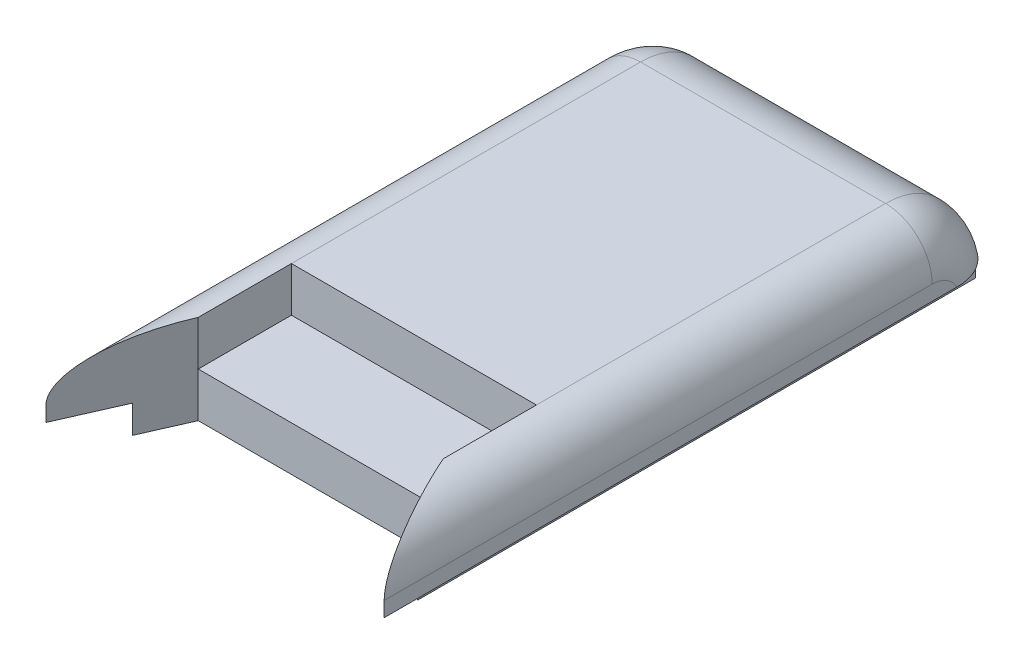
from build123d import *

# Parameters (mm, degrees)
SKETCH1_W                = 58
SKETCH1_H                = 65
BOSS_EXTRUDE1_DEPTH      = 30
BOSS_EXTRUDE3_REACH      = 92.09
SKETCH10_W               = 5
SKETCH10_H               = 14
CUT_EXTRUDE1_REACH       = 111.372
SKETCH2_R                = 2.45
SKETCH2_R_2              = 2.55
CUT_EXTRUDE2_REACH       = 91.744
SKETCH3_W                = 12.4
SKETCH3_H                = 10.4
SKETCH11_W               = 3
SKETCH11_H               = 2
BOSS_EXTRUDE4_DEPTH      = 6.3
FILLET3_R                = 1.5
SKETCH12_R               = 0.5
CUT_EXTRUDE3_DEPTH       = 92.15338732
FILLET3_OF_MIRROR1_R     = 1.5
BOSS_EXTRUDE5_REACH      = 111.564
SKETCH13_W               = 15
SKETCH13_H               = 6
BOSS_EXTRUDE6_REACH      = 111.564
SKETCH17_W               = 15
SKETCH17_H               = 14
CUT_EXTRUDE18_REACH      = 129.651
SKETCH35_W               = 16
SKETCH35_H               = 6
FILLET5_R                = 3
BOSS_EXTRUDE7_START      = 20.2
BOSS_EXTRUDE7_DEPTH      = 9.8
BOSS_EXTRUDE8_DEPTH      = 20
CUT_EXTRUDE15_REACH      = 95.637
SKETCH28_R               = 0.8
FILLET4_R                = 3
CUT_EXTRUDE16_REACH      = 96.767
SKETCH29_R               = 1.6
SKETCH30_W               = 14
SKETCH30_H               = 1.5
BOSS_EXTRUDE9_DEPTH      = 6.1
SKETCH31_W               = 1.3
SKETCH31_H               = 14
BOSS_EXTRUDE10_DEPTH     = 5
CUT_EXTRUDE17_REACH      = 99.736
FILLET11_R               = 1
FILLET11_OF_MIRROR4_R    = 1
MIRROR5_START            = 2.5
MIRROR5_OUTLINE_W        = 1.5
MIRROR5_OUTLINE_H        = 14
MIRROR5_DEPTH            = 6.1
MIRROR5_START_2          = 7.3
MIRROR5_2_DEPTH          = 1.3
SKETCH36_W               = 22.4
SKETCH36_H               = 14.8
BOSS_EXTRUDE12_DEPTH     = 14
CUT_EXTRUDE19_DEPTH      = 3
CUT_EXTRUDE20_DEPTH      = 11
CUT_EXTRUDE21_REACH      = 101.088
SKETCH41_W               = 3
SKETCH41_H               = 35
BOSS_EXTRUDE13_DEPTH     = 2
BOSS_EXTRUDE14_START     = -1.789079
SKETCH43_W               = 36.284482562
SKETCH43_H               = 9.6
BOSS_EXTRUDE14_DEPTH     = 66.789079
BOSS_EXTRUDE15_REACH     = 152.996
SKETCH44_W               = 2.842240903
SKETCH44_H               = 50
FILLET6_R                = 8
FILLET7_R                = 5
SKETCH45_W               = 17
SKETCH45_H               = 8
CUT_EXTRUDE22_DEPTH      = 166.644015889
BOSS_EXTRUDE16_REACH     = 152.29
SKETCH46_W               = 4.5
SKETCH46_H               = 5
BOSS_EXTRUDE17_START     = -30
BOSS_EXTRUDE17_DEPTH     = 30
SKETCH49_W               = 8
SKETCH49_H               = 9
CUT_EXTRUDE23_DEPTH      = 8
SKETCH50_R               = 2.45
CUT_EXTRUDE24_DEPTH      = 4.5
CUT_EXTRUDE25_START      = 13.5
SKETCH51_R               = 2.45
CUT_EXTRUDE25_DEPTH      = 4.5
BOSS_EXTRUDE18_REACH     = 165.708
SKETCH53_W               = 5
SKETCH53_H               = 10
SKETCH55_W               = 58
SKETCH55_H               = 10
BOSS_EXTRUDE20_DEPTH     = 4
CUT_EXTRUDE9_START       = -10
SKETCH19_W               = 30
SKETCH19_H               = 15
CUT_EXTRUDE9_DEPTH       = 10
SKETCH58_W               = 70
SKETCH58_H               = 9
CUT_EXTRUDE27_DEPTH      = 153.77843439
BOSS_EXTRUDE22_REACH     = 153.411
SKETCH59_W               = 30
SKETCH59_H               = 5
CUT_EXTRUDE28_REACH      = 183.113
SKETCH18_R               = 1.5
FILLET9_R                = 2
FILLET10_R               = 1
SKETCH60_W               = 70
SKETCH60_H               = 3
BOSS_EXTRUDE23_DEPTH     = 30
CUT_EXTRUDE29_DEPTH      = 7.5
CUT_EXTRUDE30_DEPTH      = 3
SKETCH64_W               = 58
SKETCH64_H               = 4
BOSS_EXTRUDE24_DEPTH     = 6
CUT_EXTRUDE31_DEPTH      = 7.5
CUT_EXTRUDE32_DEPTH      = 153.77843439
CUT_EXTRUDE32_DEPTH_BACK = 153.77843439
SKETCH66_W               = 26.284482562
SKETCH66_H               = 4.8
CUT_EXTRUDE33_DEPTH      = 10
SKETCH70_W               = 39.429423432
SKETCH70_H               = 70.844211971
CUT_EXTRUDE36_DEPTH      = 147.073785918
SKETCH71_W               = 2.84
SKETCH71_H               = 69.475636784
SKETCH71_H_2             = 74.91392287
CUT_EXTRUDE37_DEPTH      = 3


# Read off the part's stored shape, not the designer's step: Mirror5
# Some blends are built 0.0001 mm under size
with BuildPart() as part:
    # Sketch1 → Boss-Extrude1 (new body)
    with BuildSketch(Plane(origin=(0, 0, 0), x_dir=(1, 0, 0), z_dir=(0, 1, 0))):
        Polygon((-35, 38.5), (-17.352941176, 78.5), (17.352941947, 78.5), (35, 38.5), (35, -38.5), (-35, -38.5), align=None)
        Rectangle(SKETCH1_W, SKETCH1_H, mode=Mode.SUBTRACT)
        Polygon((-28.44203382, 38.5), (28.442033867, 38.5), (13.442034522, 72.5), (-13.44203382, 72.5), align=None, mode=Mode.SUBTRACT)
    extrude(amount=BOSS_EXTRUDE1_DEPTH)

    # Sketch7 → Loft3 section 0
    with BuildSketch(Plane.XY.offset(-32.5)):
        with BuildLine():
            Line((-8.6, 30), (8.6, 30))
            Line((8.6, 30), (8.6, 27))
            Line((8.6, 27), (-8.6, 27))
            Line((-8.6, 27), (-8.6, 30))
        make_face()
    # Sketch8 → Loft3 section 1
    with BuildSketch(Plane.XY.offset(38.5)):
        with BuildLine():
            Line((-8.6, 30), (8.6, 30))
            Line((8.6, 30), (8.6, 27))
            Line((8.6, 27), (-8.6, 27))
            Line((-8.6, 27), (-8.6, 30))
        make_face()
    loft3 = loft()

    # Mirror3: Loft3 across plane
    add(loft3.mirror(Plane(origin=(0, 15, 0), x_dir=(0, 0, 1), z_dir=(0, -1, 0))))

    # Sketch10 → Boss-Extrude3 (add, up to next)
    with BuildSketch(Plane.XZ.offset(-27), mode=Mode.PRIVATE) as boss_extrude3_sk1:
        with Locations((0, 2.5)):
            Rectangle(SKETCH10_W, SKETCH10_H)
    boss_extrude3_tool1 = extrude(boss_extrude3_sk1.sketch, amount=BOSS_EXTRUDE3_REACH, mode=Mode.PRIVATE) - part.part
    add(boss_extrude3_tool1.solids().sort_by_distance((0, 27, 2.5))[0])

    # Sketch2 → Cut-Extrude1 (cut, up to next)
    with BuildSketch(Plane(origin=(35, 0, 0), x_dir=(0, 0, -1), z_dir=(1, 0, 0)), mode=Mode.PRIVATE) as cut_extrude1_sk1:
        with Locations((-2.5, 15)):
            Circle(SKETCH2_R)
    cut_extrude1_tool1 = extrude(cut_extrude1_sk1.sketch, amount=-CUT_EXTRUDE1_REACH, mode=Mode.PRIVATE) & part.part
    # Sketch2 → Cut-Extrude1 (cut, up to next)
    with BuildSketch(Plane(origin=(35, 0, 0), x_dir=(0, 0, -1), z_dir=(1, 0, 0)), mode=Mode.PRIVATE) as cut_extrude1_sk2:
        with Locations((19.5, 15)):
            Circle(SKETCH2_R_2)
    cut_extrude1_tool2 = extrude(cut_extrude1_sk2.sketch, amount=-CUT_EXTRUDE1_REACH, mode=Mode.PRIVATE) & part.part
    cut_extrude1_1 = cut_extrude1_tool1.solids().sort_by_distance((35, 15, 2.5))[0]
    add(cut_extrude1_1, mode=Mode.SUBTRACT)
    cut_extrude1_2 = cut_extrude1_tool2.solids().sort_by_distance((35, 15, -19.5))[0]
    add(cut_extrude1_2, mode=Mode.SUBTRACT)
    cut_extrude1 = cut_extrude1_1 + cut_extrude1_2  # Cut-Extrude1 as one shape, for the pattern or mirror that repeats it

    # Sketch3 → Cut-Extrude2 (cut, up to next)
    with BuildSketch(Plane(origin=(0, 0, -38.5), x_dir=(-1, 0, 0), z_dir=(0, 0, -1)), mode=Mode.PRIVATE) as cut_extrude2_sk1:
        with Locations((0, 15)):
            Rectangle(SKETCH3_W, SKETCH3_H)
    cut_extrude2_tool1 = extrude(cut_extrude2_sk1.sketch, amount=-CUT_EXTRUDE2_REACH, mode=Mode.PRIVATE) & part.part
    add(cut_extrude2_tool1.solids().sort_by_distance((0, 15, -38.5))[0], mode=Mode.SUBTRACT)

    # Sketch11 → Boss-Extrude4 (add)
    with BuildSketch(Plane(origin=(35, 0, 0), x_dir=(0, 0, -1), z_dir=(1, 0, 0))):
        with Locations((2.5, 20)):
            Rectangle(SKETCH11_W, SKETCH11_H)
        with Locations((2.5, 10)):
            Rectangle(SKETCH11_W, SKETCH11_H)
    boss_extrude4 = extrude(amount=BOSS_EXTRUDE4_DEPTH)

    # Fillet3
    fillet3_edges = [part.edges().sort_by_distance(p)[0] for p in [
        (41.3, 10, -1),
        (41.3, 10, -4),
        (41.3, 20, -1),
        (41.3, 20, -4),
    ]]
    fillet(fillet3_edges, radius=FILLET3_R - 0.0001)  # a hair under: the kernel refuses the full size

    # Sketch12 → Cut-Extrude3 (cut, through all)
    with BuildSketch(Plane(origin=(0, 21, 0), x_dir=(1, 0, 0), z_dir=(0, 1, 0))):
        with Locations(Location((39.8, 2.5, 0), (0, 0, 270))):
            Circle(SKETCH12_R)
    cut_extrude3 = extrude(amount=-CUT_EXTRUDE3_DEPTH, mode=Mode.SUBTRACT)

    # Mirror1: Cut-Extrude1, Boss-Extrude4, Cut-Extrude3 across plane
    add(cut_extrude1.mirror(Plane(origin=(0, 0, 0), x_dir=(0, 0, 1), z_dir=(1, 0, 0))), mode=Mode.SUBTRACT)
    add(boss_extrude4.mirror(Plane(origin=(0, 0, 0), x_dir=(0, 0, 1), z_dir=(1, 0, 0))))
    add(cut_extrude3.mirror(Plane(origin=(0, 0, 0), x_dir=(0, 0, 1), z_dir=(1, 0, 0))), mode=Mode.SUBTRACT)

    # Fillet3 of Mirror1
    fillet3_of_mirror1_edges = [part.edges().sort_by_distance(p)[0] for p in [
        (-41.3, 10, -1),
        (-41.3, 10, -4),
        (-41.3, 20, -1),
        (-41.3, 20, -4),
    ]]
    fillet(fillet3_of_mirror1_edges, radius=FILLET3_OF_MIRROR1_R - 0.0001)  # a hair under: the kernel refuses the full size

    # Sketch13 → Boss-Extrude5 (add, up to next)
    with BuildSketch(Plane(origin=(-29, 0, 0), x_dir=(0, 0, -1), z_dir=(1, 0, 0)), mode=Mode.PRIVATE) as boss_extrude5_sk1:
        with Locations((-25, 27)):
            Rectangle(SKETCH13_W, SKETCH13_H)
    boss_extrude5_tool1 = extrude(boss_extrude5_sk1.sketch, amount=BOSS_EXTRUDE5_REACH, mode=Mode.PRIVATE) - part.part
    add(boss_extrude5_tool1.solids().sort_by_distance((-29, 27, 25))[0])

    # Sketch17 → Boss-Extrude6 (add, up to next)
    with BuildSketch(Plane(origin=(-29, 0, 0), x_dir=(0, 0, -1), z_dir=(1, 0, 0)), mode=Mode.PRIVATE) as boss_extrude6_sk1:
        with Locations((-25, 7)):
            Rectangle(SKETCH17_W, SKETCH17_H)
    boss_extrude6_tool1 = extrude(boss_extrude6_sk1.sketch, amount=BOSS_EXTRUDE6_REACH, mode=Mode.PRIVATE) - part.part
    add(boss_extrude6_tool1.solids().sort_by_distance((-29, 7, 25))[0])

    # Sketch35 → Cut-Extrude18 (cut, up to next)
    with BuildSketch(Plane(origin=(0, 0, -78.5), x_dir=(-1, 0, 0), z_dir=(0, 0, -1)), mode=Mode.PRIVATE) as cut_extrude18_sk1:
        with Locations((0, 15)):
            Rectangle(SKETCH35_W, SKETCH35_H)
    cut_extrude18_tool1 = extrude(cut_extrude18_sk1.sketch, amount=-CUT_EXTRUDE18_REACH, mode=Mode.PRIVATE) & part.part
    add(cut_extrude18_tool1.solids().sort_by_distance((0, 15, -78.5))[0], mode=Mode.SUBTRACT)

    # Fillet5
    fillet5_edges = [part.edges().sort_by_distance(p)[0] for p in [
        (-35, 15, -38.5),
        (-17.352941176, 15, -78.5),
        (17.352941947, 15, -78.5),
        (35, 15, -38.5),
        (-8, 15, -78.5),
        (8, 15, -78.5),
    ]]
    fillet(fillet5_edges, radius=FILLET5_R)

    # Sketch24 → Boss-Extrude7 (add)
    with BuildSketch(Plane(origin=(0, 0, 0), x_dir=(1, 0, 0), z_dir=(0, 1, 0)).offset(BOSS_EXTRUDE7_START)):
        Polygon((9.15, 49.5), (9.15, 72.5), (6.15, 72.5), (6.15, 49.5), (-6.15, 49.5), (-6.15, 72.5), (-9.15, 72.5), (-9.15, 49.5), (-23.589092644, 49.5), (-26.23615161, 43.5), (26.23615161, 43.5), (23.589092902, 49.5), align=None)
    extrude(amount=BOSS_EXTRUDE7_DEPTH)

    # Sketch26 → Boss-Extrude8 (add)
    with BuildSketch(Plane(origin=(0, 0, -38.5), x_dir=(-1, 0, 0), z_dir=(0, 0, -1))):
        Polygon((-11.2, 4.8), (-11.2, 0), (11.2, 0), (11.2, 4.8), (11.2, 14.8), (6.2, 14.8), (6.2, 9.8), (-6.2, 9.8), (-6.2, 14.8), (-11.2, 14.8), align=None)
    extrude(amount=BOSS_EXTRUDE8_DEPTH)

    # Sketch28 → Cut-Extrude15 (cut, up to next)
    with BuildSketch(Plane(origin=(0, 30, 0), x_dir=(-1, 0, 0), z_dir=(0, 1, 0)), mode=Mode.PRIVATE) as cut_extrude15_sk1:
        with Locations(Location((0, -46.5, 0), (0, 0, 90))):
            Circle(SKETCH28_R)
    cut_extrude15_tool1 = extrude(cut_extrude15_sk1.sketch, amount=-CUT_EXTRUDE15_REACH, mode=Mode.PRIVATE) & part.part
    # Sketch28 → Cut-Extrude15 (cut, up to next)
    with BuildSketch(Plane(origin=(0, 30, 0), x_dir=(-1, 0, 0), z_dir=(0, 1, 0)), mode=Mode.PRIVATE) as cut_extrude15_sk2:
        with Locations(Location((0, -75.5, 0), (0, 0, 90))):
            Circle(SKETCH28_R)
    cut_extrude15_tool2 = extrude(cut_extrude15_sk2.sketch, amount=-CUT_EXTRUDE15_REACH, mode=Mode.PRIVATE) & part.part
    add(cut_extrude15_tool1.solids().sort_by_distance((0, 30, -46.5))[0], mode=Mode.SUBTRACT)
    add(cut_extrude15_tool2.solids().sort_by_distance((0, 30, -75.5))[0], mode=Mode.SUBTRACT)

    # Fillet4
    fillet4_edges = [part.edges().sort_by_distance(p)[0] for p in [
        (35, 19, -2.5),
        (35, 20, -4),
        (35, 21, -2.5),
        (35, 11, -2.5),
        (35, 9, -2.5),
        (35, 10, -4),
        (-35, 19, -2.5),
        (-35, 20, -4),
        (-35, 21, -2.5),
        (-35, 11, -2.5),
        (-35, 9, -2.5),
        (-35, 10, -4),
    ]]
    fillet(fillet4_edges, radius=FILLET4_R)

    # Sketch29 → Cut-Extrude16 (cut, up to next)
    with BuildSketch(Plane(origin=(2.5, 0, 0), x_dir=(0, 0, -1), z_dir=(1, 0, 0)), mode=Mode.PRIVATE) as cut_extrude16_sk1:
        with Locations(Location((-2.5, 15, 0), (0, 0, 90))):
            Circle(SKETCH29_R)
    cut_extrude16_tool1 = extrude(cut_extrude16_sk1.sketch, amount=-CUT_EXTRUDE16_REACH, mode=Mode.PRIVATE) & part.part
    add(cut_extrude16_tool1.solids().sort_by_distance((2.5, 15, 2.5))[0], mode=Mode.SUBTRACT)

    # Sketch30 → Boss-Extrude9 (add)
    with BuildSketch(Plane.ZY.offset(2.5)):
        with Locations((2.5, 26.25)):
            Rectangle(SKETCH30_W, SKETCH30_H)
    boss_extrude9 = extrude(amount=BOSS_EXTRUDE9_DEPTH)

    # Sketch31 → Boss-Extrude10 (add)
    with BuildSketch(Plane.XZ.offset(-25.5)):
        with Locations((-7.95, 2.5)):
            Rectangle(SKETCH31_W, SKETCH31_H)
    boss_extrude10 = extrude(amount=BOSS_EXTRUDE10_DEPTH)

    # Sketch32 → Cut-Extrude17 (cut, up to next)
    with BuildSketch(Plane.ZY.offset(8.6), mode=Mode.PRIVATE) as cut_extrude17_sk1:
        with BuildLine():
            Line((-4.5, 20.5), (-4.5, 20.656854249))
            ThreePointArc((-4.5, 20.656854249), (2.5, 24), (9.5, 20.656854249))
            Line((9.5, 20.656854249), (9.5, 20.5))
            Line((9.5, 20.5), (-4.5, 20.5))
        make_face()
    cut_extrude17_tool1 = extrude(cut_extrude17_sk1.sketch, amount=-CUT_EXTRUDE17_REACH, mode=Mode.PRIVATE) & part.part
    cut_extrude17 = cut_extrude17_tool1.solids().sort_by_distance((-8.6, 21.927092, 2.5))[0]
    add(cut_extrude17, mode=Mode.SUBTRACT)

    # Fillet11
    fillet11_edges = [part.edges().sort_by_distance(p)[0] for p in [
        (-7.95, 20.656854249, 9.5),
        (-7.95, 20.656854249, -4.5),
    ]]
    fillet(fillet11_edges, radius=FILLET11_R)

    # Mirror4: Boss-Extrude9, Boss-Extrude10, Cut-Extrude17 across plane
    add(boss_extrude9.mirror(Plane(origin=(0, 15, 0), x_dir=(0, 0, 1), z_dir=(0, -1, 0))))
    add(boss_extrude10.mirror(Plane(origin=(0, 15, 0), x_dir=(0, 0, 1), z_dir=(0, -1, 0))))
    add(cut_extrude17.mirror(Plane(origin=(0, 15, 0), x_dir=(0, 0, 1), z_dir=(0, -1, 0))), mode=Mode.SUBTRACT)

    # Fillet11 of Mirror4
    fillet11_of_mirror4_edges = [part.edges().sort_by_distance(p)[0] for p in [
        (-7.95, 9.343145751, 9.5),
        (-7.95, 9.343145751, -4.5),
    ]]
    fillet(fillet11_of_mirror4_edges, radius=FILLET11_OF_MIRROR4_R)

    # Mirror5 outline → Mirror5 (add)
    with BuildSketch(Plane.YZ.offset(MIRROR5_START)):
        with Locations((3.75, 2.5)):
            Rectangle(MIRROR5_OUTLINE_W, MIRROR5_OUTLINE_H)
        with Locations((26.25, 2.5)):
            Rectangle(MIRROR5_OUTLINE_W, MIRROR5_OUTLINE_H)
    extrude(amount=MIRROR5_DEPTH)

    # Mirror5 2 outline → Mirror5 2 (add)
    with BuildSketch(Plane.YZ.offset(MIRROR5_START_2)):
        with BuildLine():
            Line((7, 9.5), (4.5, 9.5))
            Line((4.5, 9.5), (4.5, -4.5))
            Line((4.5, -4.5), (7, -4.5))
            ThreePointArc((7, -4.5), (7.894427191, -3.947213595), (7.8, -2.9))
            ThreePointArc((7.8, -2.9), (6, 2.5), (7.8, 7.9))
            ThreePointArc((7.8, 7.9), (7.894427191, 8.947213595), (7, 9.5))
        make_face()
        with BuildLine():
            Line((25.5, 9.5), (23, 9.5))
            ThreePointArc((23, 9.5), (22.105572809, 8.947213595), (22.2, 7.9))
            ThreePointArc((22.2, 7.9), (24, 2.5), (22.2, -2.9))
            ThreePointArc((22.2, -2.9), (22.105572809, -3.947213595), (23, -4.5))
            Line((23, -4.5), (25.5, -4.5))
            Line((25.5, -4.5), (25.5, 9.5))
        make_face()
    extrude(amount=MIRROR5_2_DEPTH)

    # Sketch36 → Boss-Extrude12 (add)
    with BuildSketch(Plane(origin=(0, 0, -58.5), x_dir=(-1, 0, 0), z_dir=(0, 0, -1))):
        with Locations((0, 7.4)):
            Rectangle(SKETCH36_W, SKETCH36_H)
    extrude(amount=BOSS_EXTRUDE12_DEPTH)

    # Sketch37 → Cut-Extrude19 (cut)
    with BuildSketch(Plane.XY.offset(-58.5)):
        with BuildLine():
            Line((-6, 14.8), (6, 14.8))
            ThreePointArc((6, 14.8), (5.340169944, 12.004915028), (3.5, 9.8))
            Line((3.5, 9.8), (-3.5, 9.8))
            ThreePointArc((-3.5, 9.8), (-5.340169944, 12.004915028), (-6, 14.8))
        make_face()
    extrude(amount=-CUT_EXTRUDE19_DEPTH, mode=Mode.SUBTRACT)

    # Sketch38 → Cut-Extrude20 (cut)
    with BuildSketch(Plane.XY.offset(-61.5)):
        with BuildLine():
            Line((-6, 14.8), (6, 14.8))
            ThreePointArc((6, 14.8), (0, 11.8), (-6, 14.8))
        make_face()
    extrude(amount=-CUT_EXTRUDE20_DEPTH, mode=Mode.SUBTRACT)

    # Cut-Extrude21: up to this face of the body (flat: up to its plane)
    cut_extrude21_end = Plane(part.part.faces().sort_by_distance((11.2, 7.4, -55.5))[0])
    # Sketch40 → Cut-Extrude21 (cut, up to the picked face)
    with BuildSketch(Plane.ZY.offset(11.2), mode=Mode.PRIVATE) as cut_extrude21_sk1:
        Polygon((-58.5, 14.8), (-72.5, 14.8), (-72.5, 11.8), align=None)
    cut_extrude21_tool1 = split(extrude(cut_extrude21_sk1.sketch, amount=-CUT_EXTRUDE21_REACH, mode=Mode.PRIVATE), bisect_by=cut_extrude21_end, keep=Keep.BOTH, mode=Mode.PRIVATE)
    add(cut_extrude21_tool1.solids().sort_by(Axis((-11.2, 13.8, -67.833333), (1, 0, 0)))[0], mode=Mode.SUBTRACT)

    # Sketch41 → Boss-Extrude13 (add)
    with BuildSketch(Plane(origin=(0, 30, 0), x_dir=(1, 0, 0), z_dir=(0, 1, 0))):
        with Locations((-7.65, 61)):
            Rectangle(SKETCH41_W, SKETCH41_H)
        with Locations((7.65, 61)):
            Rectangle(SKETCH41_W, SKETCH41_H)
    extrude(amount=BOSS_EXTRUDE13_DEPTH)

    # Sketch43 → Boss-Extrude14 (add)
    with BuildSketch(Plane(origin=(0, 0, -78.5), x_dir=(-1, 0, 0), z_dir=(0, 0, -1)).offset(BOSS_EXTRUDE14_START)):
        with Locations((-3.78e-07, 4.8)):
            Rectangle(SKETCH43_W, SKETCH43_H)
        with Locations((-3.78e-07, 25.2)):
            Rectangle(SKETCH43_W, SKETCH43_H)
    extrude(amount=BOSS_EXTRUDE14_DEPTH)

    # Sketch44 → Boss-Extrude15 (add, up to next)
    with BuildSketch(Plane(origin=(0, 9.6, 0), x_dir=(1, 0, 0), z_dir=(0, 1, 0)), mode=Mode.PRIVATE) as boss_extrude15_sk1:
        with Locations((-16.721120451, 118.5)):
            Rectangle(SKETCH44_W, SKETCH44_H)
    boss_extrude15_tool1 = extrude(boss_extrude15_sk1.sketch, amount=BOSS_EXTRUDE15_REACH, mode=Mode.PRIVATE) - part.part
    # Sketch44 → Boss-Extrude15 (add, up to next)
    with BuildSketch(Plane(origin=(0, 9.6, 0), x_dir=(1, 0, 0), z_dir=(0, 1, 0)), mode=Mode.PRIVATE) as boss_extrude15_sk2:
        Polygon((18.142241659, 143.5), (15.3, 143.5), (15.3, 93.5), (18.142240903, 93.5), align=None)
    boss_extrude15_tool2 = extrude(boss_extrude15_sk2.sketch, amount=BOSS_EXTRUDE15_REACH, mode=Mode.PRIVATE) - part.part
    add(boss_extrude15_tool1.solids().sort_by_distance((-16.72112, 9.6, -118.5))[0])
    add(boss_extrude15_tool2.solids().sort_by_distance((16.721121, 9.6, -118.500001))[0])

    # Fillet6
    fillet6_edges = [part.edges().sort_by_distance(p)[0] for p in [
        (3.78e-07, 0, -143.5),
        (3.78e-07, 30, -143.5),
    ]]
    fillet(fillet6_edges, radius=FILLET6_R)

    # Fillet7
    # the kernel refuses this fillet: 5 mm, written as the material it takes off along each edge
    with BuildSketch(Plane(origin=(18.142241659, 0, -64.210921), x_dir=(-1, 0, 0), z_dir=(0, 0, -1))) as fillet7_piece_1_section:
        with BuildLine():
            CenterArc((FILLET7_R, FILLET7_R), FILLET7_R, 180, 90)
            Line((0, FILLET7_R), (0, 0))
            Line((0, 0), (FILLET7_R, 0))
        make_face()
    fillet7_piece_1 = extrude(amount=71.289079, mode=Mode.PRIVATE)
    fillet7_piece_1 = split(fillet7_piece_1, bisect_by=Plane(origin=(6.655944686, 1.159648817, -102.746528186), z_dir=(0.9149178080838143, 0, -0.4036401918182936)), keep=Keep.TOP, mode=Mode.PRIVATE)
    with BuildSketch(Plane(origin=(18.142241659, 8, -135.5), x_dir=(0, -1, 0), z_dir=(0, 0, 1))) as fillet7_piece_2:
        with BuildLine():
            CenterArc((8 - FILLET7_R, -FILLET7_R), FILLET7_R, 0, 90)
            Line((8 - FILLET7_R, 0), (8, 0))
            Line((8, 0), (8, -FILLET7_R))
        make_face()
    fillet7_piece_2_solid = revolve(axis=Axis((18.142241659, 8, -135.5), (1, 0, 0)), revolution_arc=90, mode=Mode.PRIVATE)
    with BuildSketch(Plane(origin=(18.142241659, 9.6, -143.5), x_dir=(-1, 0, 0), z_dir=(0, 1, 0))) as fillet7_piece_3:
        with BuildLine():
            CenterArc((FILLET7_R * 1.00000001512, FILLET7_R), FILLET7_R, 179.999999134, 90.000000866)
            Line((FILLET7_R * 1.511713279e-08, FILLET7_R * 1.00000001512), (0, 0))
            Line((0, 0), (FILLET7_R * 1.00000001512, 0))
        make_face()
    fillet7_piece_3_solid = extrude(amount=10.8, mode=Mode.PRIVATE)
    with BuildSketch(Plane(origin=(18.142241659, 22, -135.5), x_dir=(0, 1, 0), z_dir=(0, 0, 1))) as fillet7_piece_4:
        with BuildLine():
            CenterArc((8 - FILLET7_R, FILLET7_R), FILLET7_R, 270, 90)
            Line((8 - FILLET7_R, 0), (8, 0))
            Line((8, 0), (8, FILLET7_R))
        make_face()
    fillet7_piece_4_solid = revolve(axis=Axis((18.142241659, 22, -135.5), (-1, 0, 0)), revolution_arc=90, mode=Mode.PRIVATE)
    with BuildSketch(Plane(origin=(-18.142240903, 0, -64.210921), x_dir=(0, 1, 0), z_dir=(0, 0, -1))) as fillet7_piece_5_section:
        with BuildLine():
            CenterArc((FILLET7_R, FILLET7_R), FILLET7_R, 180, 90)
            Line((0, FILLET7_R), (0, 0))
            Line((0, 0), (FILLET7_R, 0))
        make_face()
    fillet7_piece_5 = extrude(amount=71.289079, mode=Mode.PRIVATE)
    fillet7_piece_5 = split(fillet7_piece_5, bisect_by=Plane(origin=(-6.655943611, 1.159648816, -102.746527816), z_dir=(-0.914917801572932, 0, -0.40364020657629374)), keep=Keep.TOP, mode=Mode.PRIVATE)
    with BuildSketch(Plane(origin=(-18.142240903, 8, -135.5), x_dir=(0, -1, 0), z_dir=(0, 0, 1))) as fillet7_piece_6:
        with BuildLine():
            CenterArc((8 - FILLET7_R, FILLET7_R), FILLET7_R, 270, 90)
            Line((8, FILLET7_R), (8, 0))
            Line((8, 0), (8 - FILLET7_R, 0))
        make_face()
    fillet7_piece_6_solid = revolve(axis=Axis((-18.142240903, 8, -135.5), (1, 0, 0)), revolution_arc=90, mode=Mode.PRIVATE)
    with BuildSketch(Plane(origin=(-18.142240903, 22, -143.5), x_dir=(0, 0, 1), z_dir=(0, -1, 0))) as fillet7_piece_7:
        with BuildLine():
            CenterArc((FILLET7_R, -FILLET7_R), FILLET7_R, 90, 90)
            Line((0, -FILLET7_R), (0, 0))
            Line((0, 0), (FILLET7_R, 0))
        make_face()
    fillet7_piece_7_solid = extrude(amount=14, mode=Mode.PRIVATE)
    with BuildSketch(Plane(origin=(-18.142240903, 22, -135.5), x_dir=(0, 1, 0), z_dir=(0, 0, 1))) as fillet7_piece_8:
        with BuildLine():
            CenterArc((8 - FILLET7_R, -FILLET7_R), FILLET7_R, 0, 90)
            Line((8, -FILLET7_R), (8, 0))
            Line((8, 0), (8 - FILLET7_R, 0))
        make_face()
    fillet7_piece_8_solid = revolve(axis=Axis((-18.142240903, 22, -135.5), (-1, 0, 0)), revolution_arc=90, mode=Mode.PRIVATE)
    with BuildSketch(Plane(origin=(18.142241659, 30, -64.210921), x_dir=(-1, 0, 0), z_dir=(0, 0, -1))) as fillet7_piece_9_section:
        with BuildLine():
            CenterArc((FILLET7_R, -FILLET7_R), FILLET7_R, 90, 90)
            Line((0, -FILLET7_R), (0, 0))
            Line((0, 0), (FILLET7_R, 0))
        make_face()
    fillet7_piece_9 = extrude(amount=71.289079, mode=Mode.PRIVATE)
    fillet7_piece_9 = split(fillet7_piece_9, bisect_by=Plane(origin=(6.655944686, 28.840351183, -102.746528186), z_dir=(0.9149178080838143, 0, -0.4036401918182936)), keep=Keep.TOP, mode=Mode.PRIVATE)
    with BuildSketch(Plane(origin=(-18.142240903, 30, -64.210921), x_dir=(1, 0, 0), z_dir=(0, 0, -1))) as fillet7_piece_10_section:
        with BuildLine():
            CenterArc((FILLET7_R, FILLET7_R), FILLET7_R, 180, 90)
            Line((0, FILLET7_R), (0, 0))
            Line((0, 0), (FILLET7_R, 0))
        make_face()
    fillet7_piece_10 = extrude(amount=71.289079, mode=Mode.PRIVATE)
    fillet7_piece_10 = split(fillet7_piece_10, bisect_by=Plane(origin=(-6.655943611, 28.840351184, -102.746527816), z_dir=(-0.914917801572932, 0, -0.40364020657629374)), keep=Keep.TOP, mode=Mode.PRIVATE)
    with BuildSketch(Plane(origin=(18.142241659, 20.4, -143.5), x_dir=(0, 0, 1), z_dir=(0, 1, 0)), Plane(origin=(18.142241659, 9.6, -143.5), x_dir=(-1, 0, 0), z_dir=(0, -1, 0))) as fillet7_piece_11:
        with BuildLine():
            CenterArc((FILLET7_R, -FILLET7_R), FILLET7_R, 90, 90)
            Line((0, -FILLET7_R), (0, 0))
            Line((0, 0), (FILLET7_R, 0))
        make_face()
    fillet7_piece_11_solid = extrude(amount=1.6, mode=Mode.PRIVATE)
    add([fillet7_piece_1, fillet7_piece_2_solid, fillet7_piece_3_solid, fillet7_piece_4_solid, fillet7_piece_5, fillet7_piece_6_solid, fillet7_piece_7_solid, fillet7_piece_8_solid, fillet7_piece_9, fillet7_piece_10, fillet7_piece_11_solid], mode=Mode.SUBTRACT)

    # Sketch45 → Cut-Extrude22 (cut, through all)
    with BuildSketch(Plane(origin=(35, 0, 0), x_dir=(0, 0, -1), z_dir=(1, 0, 0))):
        with Locations((-24, 19)):
            Rectangle(SKETCH45_W, SKETCH45_H)
    extrude(amount=-CUT_EXTRUDE22_DEPTH, mode=Mode.SUBTRACT)

    # Sketch46 → Boss-Extrude16 (add, up to next)
    with BuildSketch(Plane(origin=(0, 15, 0), x_dir=(1, 0, 0), z_dir=(0, 1, 0)), mode=Mode.PRIVATE) as boss_extrude16_sk1:
        with Locations((31.25, -30)):
            Rectangle(SKETCH46_W, SKETCH46_H)
    boss_extrude16_tool1 = extrude(boss_extrude16_sk1.sketch, amount=BOSS_EXTRUDE16_REACH, mode=Mode.PRIVATE) - part.part
    boss_extrude16 = boss_extrude16_tool1.solids().sort_by_distance((31.25, 15, 30))[0]
    add(boss_extrude16)

    # Sketch48 → Boss-Extrude17 (add)
    with BuildSketch(Plane.XZ.offset(BOSS_EXTRUDE17_START)):
        with BuildLine():
            Line((35, 29.5), (39, 29.5))
            ThreePointArc((39, 29.5), (43, 25.5), (39, 21.5))
            Line((39, 21.5), (35, 21.5))
            Line((35, 21.5), (35, 29.5))
        make_face()
    boss_extrude17 = extrude(amount=BOSS_EXTRUDE17_DEPTH)

    # Sketch49 → Cut-Extrude23 (cut)
    with BuildSketch(Plane.XY.offset(29.5)):
        with Locations((39, 19)):
            Rectangle(SKETCH49_W, SKETCH49_H)
    cut_extrude23 = extrude(amount=-CUT_EXTRUDE23_DEPTH, mode=Mode.SUBTRACT)

    # Sketch50 → Cut-Extrude24 (cut)
    with BuildSketch(Plane(origin=(0, 14.5, 0), x_dir=(1, 0, 0), z_dir=(0, 1, 0))):
        with Locations(Location((39, -25.5, 0), (0, 0, 270))):
            Circle(SKETCH50_R)
    cut_extrude24 = extrude(amount=-CUT_EXTRUDE24_DEPTH, mode=Mode.SUBTRACT)

    # Sketch51 → Cut-Extrude25 (cut)
    with BuildSketch(Plane(origin=(0, 14.5, 0), x_dir=(1, 0, 0), z_dir=(0, 1, 0)).offset(CUT_EXTRUDE25_START)):
        with Locations(Location((39, -25.5, 0), (0, 0, 270))):
            Circle(SKETCH51_R)
    cut_extrude25 = extrude(amount=-CUT_EXTRUDE25_DEPTH, mode=Mode.SUBTRACT)

    # Mirror7: Boss-Extrude16, Boss-Extrude17, Cut-Extrude23, Cut-Extrude24, Cut-Extrude25 across plane
    add(boss_extrude16.mirror(Plane(origin=(0, 0, 0), x_dir=(0, 0, 1), z_dir=(1, 0, 0))))
    add(boss_extrude17.mirror(Plane(origin=(0, 0, 0), x_dir=(0, 0, 1), z_dir=(1, 0, 0))))
    add(cut_extrude23.mirror(Plane(origin=(0, 0, 0), x_dir=(0, 0, 1), z_dir=(1, 0, 0))), mode=Mode.SUBTRACT)
    add(cut_extrude24.mirror(Plane(origin=(0, 0, 0), x_dir=(0, 0, 1), z_dir=(1, 0, 0))), mode=Mode.SUBTRACT)
    add(cut_extrude25.mirror(Plane(origin=(0, 0, 0), x_dir=(0, 0, 1), z_dir=(1, 0, 0))), mode=Mode.SUBTRACT)

    # Sketch53 → Boss-Extrude18 (add, up to next)
    with BuildSketch(Plane.ZY.offset(-29), mode=Mode.PRIVATE) as boss_extrude18_sk1:
        with Locations((30, 19)):
            Rectangle(SKETCH53_W, SKETCH53_H)
    boss_extrude18_tool1 = extrude(boss_extrude18_sk1.sketch, amount=BOSS_EXTRUDE18_REACH, mode=Mode.PRIVATE) - part.part
    add(boss_extrude18_tool1.solids().sort_by_distance((29, 19, 30))[0])

    # Sketch55 → Boss-Extrude20 (add)
    with BuildSketch(Plane(origin=(0, 0, 27.5), x_dir=(-1, 0, 0), z_dir=(0, 0, -1))):
        with Locations((0, 19)):
            Rectangle(SKETCH55_W, SKETCH55_H)
    extrude(amount=BOSS_EXTRUDE20_DEPTH)

    # Sketch19 → Cut-Extrude9 (cut)
    with BuildSketch(Plane(origin=(0, 30, 0), x_dir=(1, 0, 0), z_dir=(0, 1, 0)).offset(CUT_EXTRUDE9_START)):
        with Locations((0, -25)):
            Rectangle(SKETCH19_W, SKETCH19_H)
    extrude(amount=-CUT_EXTRUDE9_DEPTH, mode=Mode.SUBTRACT)

    # Sketch58 → Cut-Extrude27 (cut, through all)
    with BuildSketch(Plane(origin=(0, 30, 0), x_dir=(1, 0, 0), z_dir=(0, 1, 0))):
        with Locations((0, -34)):
            Rectangle(SKETCH58_W, SKETCH58_H)
    extrude(amount=-CUT_EXTRUDE27_DEPTH, mode=Mode.SUBTRACT)

    # Sketch59 → Boss-Extrude22 (add, up to next)
    with BuildSketch(Plane(origin=(0, 10, 0), x_dir=(1, 0, 0), z_dir=(0, 1, 0)), mode=Mode.PRIVATE) as boss_extrude22_sk1:
        with Locations((0, -27)):
            Rectangle(SKETCH59_W, SKETCH59_H)
    boss_extrude22_tool1 = extrude(boss_extrude22_sk1.sketch, amount=BOSS_EXTRUDE22_REACH, mode=Mode.PRIVATE) - part.part
    add(boss_extrude22_tool1.solids().sort_by_distance((0, 10, 27))[0])

    # Sketch18 → Cut-Extrude28 (cut, up to next)
    with BuildSketch(Plane.XY.offset(29.5), mode=Mode.PRIVATE) as cut_extrude28_sk1:
        with Locations((7.5, 15)):
            Circle(SKETCH18_R)
    cut_extrude28_tool1 = extrude(cut_extrude28_sk1.sketch, amount=-CUT_EXTRUDE28_REACH, mode=Mode.PRIVATE) & part.part
    # Sketch18 → Cut-Extrude28 (cut, up to next)
    with BuildSketch(Plane.XY.offset(29.5), mode=Mode.PRIVATE) as cut_extrude28_sk2:
        with Locations((-7.5, 15)):
            Circle(SKETCH18_R)
    cut_extrude28_tool2 = extrude(cut_extrude28_sk2.sketch, amount=-CUT_EXTRUDE28_REACH, mode=Mode.PRIVATE) & part.part
    add(cut_extrude28_tool1.solids().sort_by_distance((7.5, 15, 29.5))[0], mode=Mode.SUBTRACT)
    add(cut_extrude28_tool2.solids().sort_by_distance((-7.5, 15, 29.5))[0], mode=Mode.SUBTRACT)

    # Fillet9
    fillet9_edges = [part.edges().sort_by_distance(p)[0] for p in [
        (6, 15, 24.5),
        (-9, 15, 24.5),
    ]]
    fillet(fillet9_edges, radius=FILLET9_R)

    # Fillet10
    fillet10_edges = [part.edges().sort_by_distance(p)[0] for p in [
        (6, 15, 29.5),
        (-9, 15, 29.5),
    ]]
    fillet(fillet10_edges, radius=FILLET10_R)

    # Sketch60 → Boss-Extrude23 (add)
    with BuildSketch(Plane.XZ):
        with Locations((0, 31)):
            Rectangle(SKETCH60_W, SKETCH60_H)
    extrude(amount=-BOSS_EXTRUDE23_DEPTH)

    # Sketch61 → Cut-Extrude29 (cut)
    with BuildSketch(Plane.XZ):
        Polygon((11.5, 32.5), (-11.5, 32.5), (-14.5, 25), (14.5, 25), align=None)
    extrude(amount=-CUT_EXTRUDE29_DEPTH, mode=Mode.SUBTRACT)

    # Sketch62 → Cut-Extrude30 (cut)
    with BuildSketch(Plane.XY.offset(32.5)):
        with BuildLine():
            Line((-7.5, 17.5), (7.5, 17.5))
            ThreePointArc((7.5, 17.5), (10, 15), (7.5, 12.5))
            Line((7.5, 12.5), (-7.5, 12.5))
            ThreePointArc((-7.5, 12.5), (-10, 15), (-7.5, 17.5))
        make_face()
    extrude(amount=-CUT_EXTRUDE30_DEPTH, mode=Mode.SUBTRACT)

    # Sketch64 → Boss-Extrude24 (add)
    with BuildSketch(Plane(origin=(0, 0, 23.5), x_dir=(-1, 0, 0), z_dir=(0, 0, -1))):
        with Locations((0, 22)):
            Rectangle(SKETCH64_W, SKETCH64_H)
    extrude(amount=BOSS_EXTRUDE24_DEPTH)

    # Sketch63 → Cut-Extrude31 (cut)
    with BuildSketch(Plane(origin=(0, 30, 0), x_dir=(1, 0, 0), z_dir=(0, 1, 0))):
        Polygon((-11.5, -32.5), (11.5, -32.5), (14.5, -25), (-14.5, -25), align=None)
    extrude(amount=-CUT_EXTRUDE31_DEPTH, mode=Mode.SUBTRACT)

    # Sketch65 → Cut-Extrude32 (cut, two sides: drawn at the far end of the back side and taken through both)
    with BuildSketch(Plane(origin=(0, 30, 0), x_dir=(1, 0, 0), z_dir=(0, 1, 0)).offset(-CUT_EXTRUDE32_DEPTH_BACK)):
        Polygon((-13.142240903, 88.044253953), (13.142241659, 88.044254404), (34.744753424, 39.07855893), (50.723439189, 39.07855893), (50.723439189, -48.562723067), (-55.466291901, -48.562723067), (-55.466291901, 39.078558949), (-34.744753405, 39.078558949), align=None)
    extrude(amount=CUT_EXTRUDE32_DEPTH + CUT_EXTRUDE32_DEPTH_BACK, mode=Mode.SUBTRACT)

    # Sketch66 → Cut-Extrude33 (cut)
    with BuildSketch(Plane(origin=(-1.51e-06, 0, -88.044254178), x_dir=(0.9999999999999999, 0, -1.7148916448299635e-08), z_dir=(1.7148916448299635e-08, 0, 0.9999999999999999))):
        with Locations((1.888e-06, 2.4)):
            Rectangle(SKETCH66_W, SKETCH66_H)
        with Locations((1.888e-06, 27.6)):
            Rectangle(SKETCH66_W, SKETCH66_H)
    extrude(amount=-CUT_EXTRUDE33_DEPTH, mode=Mode.SUBTRACT)

    # Sketch70 → Cut-Extrude36 (cut, through all)
    with BuildSketch(Plane.XZ.offset(-20.4)):
        with Locations((1.572470813, -112.133026606)):
            Rectangle(SKETCH70_W, SKETCH70_H)
    extrude(amount=CUT_EXTRUDE36_DEPTH, mode=Mode.SUBTRACT)

    # Sketch71 → Cut-Extrude37 (cut)
    with BuildSketch(Plane.XZ.offset(-20.4)):
        with Locations((-16.722240903, -111.448739012)):
            Rectangle(SKETCH71_W, SKETCH71_H)
        with Locations((16.722241659, -114.16788201)):
            Rectangle(SKETCH71_W, SKETCH71_H_2)
    extrude(amount=-CUT_EXTRUDE37_DEPTH, mode=Mode.SUBTRACT)


solid = part.part
